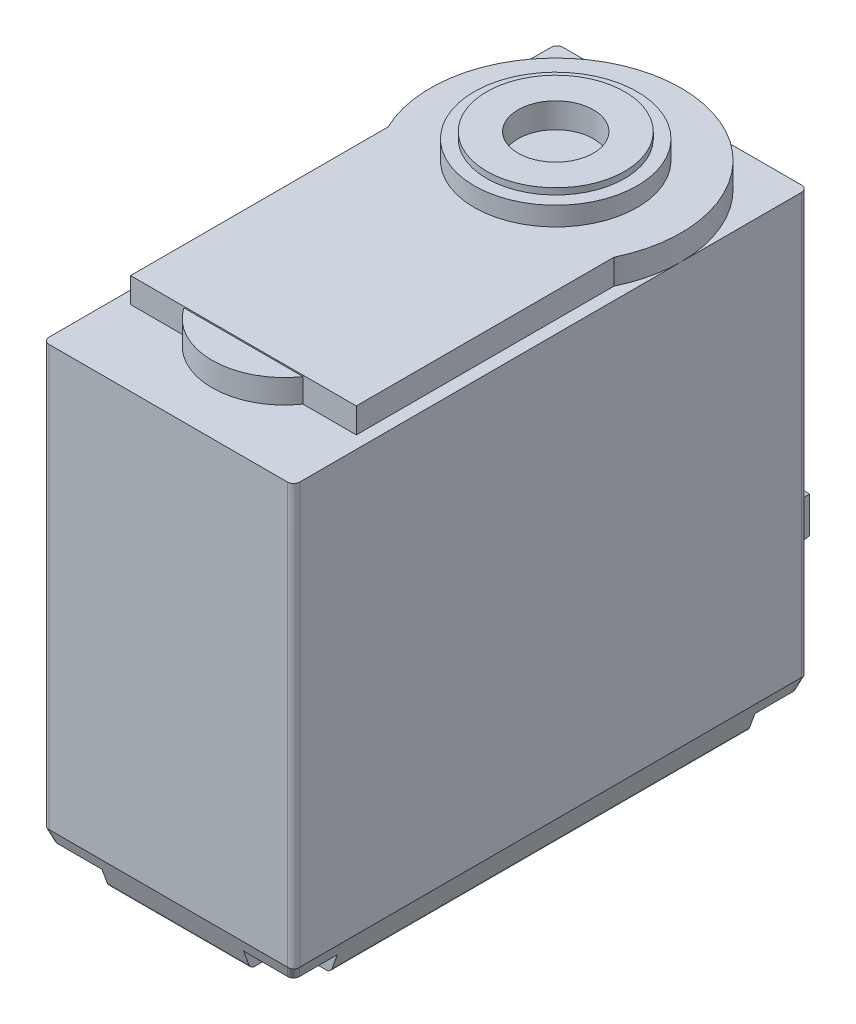
from build123d import *

# Parameters (mm, degrees)
SKETCH1_W             = 41
SKETCH1_H             = 36
BOSS_EXTRUDE1_DEPTH   = 20
BOSS_EXTRUDE2_DEPTH   = 2
BOSS_EXTRUDE3_DEPTH   = 1.9
SKETCH3_R             = 6.5
SKETCH3_R_2           = 5.5
BOSS_EXTRUDE4_DEPTH   = 1.5
SKETCH3_3_R           = 5.5
SKETCH3_3_R_2         = 3
BOSS_EXTRUDE5_DEPTH   = 2
SKETCH10_R            = 0.825
CUT_EXTRUDE3_DEPTH    = 1.5
SKETCH10_10_R         = 0.825
CUT_EXTRUDE4_DEPTH    = 32
CHAMFER2_SIZE         = 2.5
CHAMFER2_SIZE2        = 0.909925586
CHAMFER2_PART_2_SIZE  = 2.5
CHAMFER2_PART_2_SIZE2 = 0.909925586
CHAMFER2_PART_3_SIZE  = 2.5
CHAMFER2_PART_3_SIZE2 = 0.909925586
CHAMFER2_PART_4_SIZE  = 2.5
CHAMFER2_PART_4_SIZE2 = 0.909925586
FILLET2_R             = 0.5
SKETCH11_W            = 7.5
SKETCH11_H            = 4.1
BOSS_EXTRUDE10_DEPTH  = 7
BOSS_EXTRUDE10_TAPER  = 5


with BuildPart() as part:
    # Sketch1 → Boss-Extrude1 (new body)
    with BuildSketch(Plane(origin=(0, 0, 0), x_dir=(0, 0, -1), z_dir=(1, 0, 0))):
        Rectangle(SKETCH1_W, SKETCH1_H)
    extrude(amount=BOSS_EXTRUDE1_DEPTH)

    # Sketch2 → Boss-Extrude2 (add)
    with BuildSketch(Plane(origin=(0, 18, 0), x_dir=(1, 0, 0), z_dir=(0, 1, 0))):
        with BuildLine():
            ThreePointArc((20, 10.4), (7.763932023, 20.146794345), (1, 6.041101056))
            Line((1, 6.041101056), (1, 10.5))
            Line((1, 10.5), (19, 10.5))
            Line((19, 10.5), (19, 6.041101056))
            ThreePointArc((19, 6.041101056), (19.746794345, 8.163932022), (20, 10.4))
        make_face()
        with BuildLine():
            Line((1, 10.5), (1, 6.041101056))
            ThreePointArc((1, 6.041101056), (10, 0.4), (19, 6.041101056))
            Line((19, 6.041101056), (19, 10.5))
            Line((19, 10.5), (1, 10.5))
        make_face()
        with BuildLine():
            Line((1, 6.041101056), (1, -14.5))
            Line((1, -14.5), (5.25, -14.5))
            Line((5.25, -14.5), (14.75, -14.5))
            Line((14.75, -14.5), (19, -14.5))
            Line((19, -14.5), (19, 6.041101056))
            ThreePointArc((19, 6.041101056), (10, 0.4), (1, 6.041101056))
        make_face()
    extrude(amount=BOSS_EXTRUDE2_DEPTH)

    # Sketch2<3> → Boss-Extrude3 (add)
    with BuildSketch(Plane(origin=(0, 18, 0), x_dir=(1, 0, 0), z_dir=(0, 1, 0))):
        with BuildLine():
            Line((14.75, -14.5), (5.25, -14.5))
            ThreePointArc((5.25, -14.5), (10, -17), (14.75, -14.5))
        make_face()
    extrude(amount=BOSS_EXTRUDE3_DEPTH)

    # Sketch3 → Boss-Extrude4 (add)
    with BuildSketch(Plane(origin=(0, 20, 0), x_dir=(1, 0, 0), z_dir=(0, 1, 0))):
        with Locations(Location((10, 10.4, 0), (0, 0, 270))):
            Circle(SKETCH3_R)
        with Locations(Location((10, 10.4, 0), (0, 0, 270))):
            Circle(SKETCH3_R_2, mode=Mode.SUBTRACT)
    extrude(amount=BOSS_EXTRUDE4_DEPTH)

    # Sketch3<3> → Boss-Extrude5 (add)
    with BuildSketch(Plane(origin=(0, 20, 0), x_dir=(1, 0, 0), z_dir=(0, 1, 0))):
        with Locations(Location((10, 10.4, 0), (0, 0, 270))):
            Circle(SKETCH3_3_R)
        with Locations(Location((10, 10.4, 0), (0, 0, 270))):
            Circle(SKETCH3_3_R_2, mode=Mode.SUBTRACT)
    extrude(amount=BOSS_EXTRUDE5_DEPTH)

    # Sketch10 → Cut-Extrude3 (cut)
    # profile 1 of 4: a face of its own
    with BuildSketch(Plane.XZ.offset(18)):
        with BuildLine():
            Line((0, 16.65), (2.5, 16.65))
            ThreePointArc((2.5, 16.65), (3.808147545, 17.191852455), (4.35, 18.5))
            Line((4.35, 18.5), (4.35, 20.5))
            Line((4.35, 20.5), (0, 20.5))
            Line((0, 20.5), (0, 16.65))
        make_face()
        with Locations(Location((2.5, 18.5, 0), (0, 0, 270))):
            Circle(SKETCH10_R, mode=Mode.SUBTRACT)
    # profile 2 of 4: a face of its own
    with BuildSketch(Plane.XZ.offset(18)):
        with BuildLine():
            Line((15.65, 18.5), (15.65, 20.5))
            Line((15.65, 20.5), (20, 20.5))
            Line((20, 20.5), (20, 16.65))
            Line((20, 16.65), (17.5, 16.65))
            ThreePointArc((17.5, 16.65), (16.191852455, 17.191852455), (15.65, 18.5))
        make_face()
        with Locations(Location((17.5, 18.5, 0), (0, 0, 90))):
            Circle(SKETCH10_R, mode=Mode.SUBTRACT)
    # profile 3 of 4: a face of its own
    with BuildSketch(Plane.XZ.offset(18)):
        with BuildLine():
            Line((4.35, -18.5), (4.35, -20.5))
            Line((4.35, -20.5), (0, -20.5))
            Line((0, -20.5), (0, -16.65))
            Line((0, -16.65), (2.5, -16.65))
            ThreePointArc((2.5, -16.65), (3.808147545, -17.191852455), (4.35, -18.5))
        make_face()
        with Locations(Location((2.5, -18.5, 0), (0, 0, 90))):
            Circle(SKETCH10_R, mode=Mode.SUBTRACT)
    # profile 4 of 4: a face of its own
    with BuildSketch(Plane.XZ.offset(18)):
        with BuildLine():
            Line((20, -16.65), (17.5, -16.65))
            ThreePointArc((17.5, -16.65), (16.191852455, -17.191852455), (15.65, -18.5))
            Line((15.65, -18.5), (15.65, -20.5))
            Line((15.65, -20.5), (20, -20.5))
            Line((20, -20.5), (20, -16.65))
        make_face()
        with Locations(Location((17.5, -18.5, 0), (0, 0, 270))):
            Circle(SKETCH10_R, mode=Mode.SUBTRACT)
    extrude(amount=-CUT_EXTRUDE3_DEPTH, mode=Mode.SUBTRACT)

    # Sketch10<10> → Cut-Extrude4 (cut)
    with BuildSketch(Plane.XZ.offset(18)):
        with Locations(Location((2.5, 18.5, 0), (0, 0, 270))):
            Circle(SKETCH10_10_R)
        with Locations(Location((17.5, 18.5, 0), (0, 0, 270))):
            Circle(SKETCH10_10_R)
        with Locations(Location((17.5, -18.5, 0), (0, 0, 270))):
            Circle(SKETCH10_10_R)
        with Locations(Location((2.5, -18.5, 0), (0, 0, 270))):
            Circle(SKETCH10_10_R)
    extrude(amount=-CUT_EXTRUDE4_DEPTH, mode=Mode.SUBTRACT)

    # Chamfer2
    chamfer2_edges = [part.edges().sort_by_distance(p)[0] for p in [
        (10, -18, 20.5),
    ]]
    chamfer2_side = [part.faces().sort_by_distance(p)[0] for p in [
        (10, 0.318427753, 20.5),
    ]]
    chamfer(chamfer2_edges, length=CHAMFER2_SIZE, length2=CHAMFER2_SIZE2, reference=chamfer2_side[0])

    # Chamfer2 part 2
    chamfer2_part_2_edges = [part.edges().sort_by_distance(p)[0] for p in [
        (20, -18, 0),
    ]]
    chamfer2_part_2_side = [part.faces().sort_by_distance(p)[0] for p in [
        (20, 0.13604937, 0),
    ]]
    chamfer(chamfer2_part_2_edges, length=CHAMFER2_PART_2_SIZE, length2=CHAMFER2_PART_2_SIZE2, reference=chamfer2_part_2_side[0])

    # Chamfer2 part 3
    chamfer2_part_3_edges = [part.edges().sort_by_distance(p)[0] for p in [
        (10, -18, -20.5),
    ]]
    chamfer2_part_3_side = [part.faces().sort_by_distance(p)[0] for p in [
        (10, 0.318427753, -20.5),
    ]]
    chamfer(chamfer2_part_3_edges, length=CHAMFER2_PART_3_SIZE, length2=CHAMFER2_PART_3_SIZE2, reference=chamfer2_part_3_side[0])

    # Chamfer2 part 4
    chamfer2_part_4_edges = [part.edges().sort_by_distance(p)[0] for p in [
        (0, -18, 0),
    ]]
    chamfer2_part_4_side = [part.faces().sort_by_distance(p)[0] for p in [
        (0, 0.13604937, 0),
    ]]
    chamfer(chamfer2_part_4_edges, length=CHAMFER2_PART_4_SIZE, length2=CHAMFER2_PART_4_SIZE2, reference=chamfer2_part_4_side[0])

    # Fillet2
    # the kernel refuses this fillet: 0.5 mm, written as the material it takes off along each edge
    with BuildSketch(Plane(origin=(20, 19.25, 20.5), x_dir=(-1, 0, 0), z_dir=(0, -1, 0)), Plane(origin=(0, -16.75, -20.5), x_dir=(0, 0, 1), z_dir=(0, 1, 0)), Plane(origin=(20, -16.75, -20.5), x_dir=(-1, 0, 0), z_dir=(0, 1, 0)), Plane(origin=(0, 19.25, 20.5), x_dir=(0, 0, -1), z_dir=(0, -1, 0))) as fillet2_piece_1:
        with BuildLine():
            CenterArc((FILLET2_R, FILLET2_R), FILLET2_R, 180, 90)
            Line((0, FILLET2_R), (0, 0))
            Line((0, 0), (FILLET2_R, 0))
        make_face()
    extrude(amount=36, mode=Mode.SUBTRACT)
    with BuildSketch(Plane(origin=(19.090074414, -18, 17.525259423), x_dir=(-1, 0, 0), z_dir=(0, 0, -1))) as fillet2_piece_2:
        with BuildLine():
            CenterArc((FILLET2_R * 0.70020753821, FILLET2_R), FILLET2_R, 200, 70)
            Line((-FILLET2_R * 0.239485082576, FILLET2_R * 0.657979856674), (0, 0))
            Line((0, 0), (FILLET2_R * 0.70020753821, 0))
        make_face()
    extrude(amount=35.050518846, mode=Mode.SUBTRACT)
    with BuildSketch(Plane(origin=(3.474740577, -18, 19.590074414), x_dir=(0, 0, -1), z_dir=(1, 0, 0))) as fillet2_piece_3:
        with BuildLine():
            CenterArc((FILLET2_R * 0.70020753821, FILLET2_R), FILLET2_R, 200, 70)
            Line((-FILLET2_R * 0.239485082576, FILLET2_R * 0.657979856674), (0, 0))
            Line((0, 0), (FILLET2_R * 0.70020753821, 0))
        make_face()
    extrude(amount=13.050518846, mode=Mode.SUBTRACT)
    with BuildSketch(Plane(origin=(0.909925586, -18, 17.525259423), x_dir=(1, 0, 0), z_dir=(0, 0, -1))) as fillet2_piece_4:
        with BuildLine():
            CenterArc((FILLET2_R * 0.70020753821, -FILLET2_R), FILLET2_R, 90, 70)
            Line((-FILLET2_R * 0.239485082576, -FILLET2_R * 0.657979856674), (0, 0))
            Line((0, 0), (FILLET2_R * 0.70020753821, 0))
        make_face()
    extrude(amount=35.050518846, mode=Mode.SUBTRACT)
    with BuildSketch(Plane(origin=(3.474740577, -18, -19.590074414), x_dir=(0, 0, 1), z_dir=(1, 0, 0))) as fillet2_piece_5:
        with BuildLine():
            CenterArc((FILLET2_R * 0.70020753821, -FILLET2_R), FILLET2_R, 90, 70)
            Line((-FILLET2_R * 0.239485082576, -FILLET2_R * 0.657979856674), (0, 0))
            Line((0, 0), (FILLET2_R * 0.70020753821, 0))
        make_face()
    extrude(amount=13.050518846, mode=Mode.SUBTRACT)
    with BuildSketch(Plane(origin=(20.359668978, -14.511817604, 20.859668978), x_dir=(-0.9461886483394649, 0.3040991697893318, 0.1106830460683808), z_dir=(-0.3236155771181854, -0.8891264907159879, -0.3236155771181854)), Plane(origin=(-0.359668978, -14.511817604, 20.859668978), x_dir=(-0.11068304606838054, 0.30409916978933194, -0.9461886483394649), z_dir=(0.3236155771181852, -0.8891264907159879, -0.32361557711818534))) as fillet2_piece_6:
        with BuildLine():
            CenterArc((FILLET2_R * 0.889126490716, FILLET2_R), FILLET2_R, 186.717713464, 83.282286536)
            Line((-FILLET2_R * 0.104008041637, FILLET2_R * 0.883022221559), (0, 0))
            Line((0, 0), (FILLET2_R * 0.889126490716, 0))
        make_face()
    extrude(amount=3.347515592, mode=Mode.SUBTRACT)
    with BuildSketch(Plane(origin=(20.359668978, -14.511817604, -20.859668978), x_dir=(-0.9461886483394651, 0.3040991697893314, -0.1106830460683821), z_dir=(-0.3236155771181854, -0.8891264907159879, 0.3236155771181854)), Plane(origin=(-0.359668978, -14.511817604, -20.859668978), x_dir=(-0.11068304606838054, 0.30409916978933194, 0.946188648339465), z_dir=(0.3236155771181852, -0.8891264907159879, 0.32361557711818534))) as fillet2_piece_7:
        with BuildLine():
            CenterArc((FILLET2_R * 0.889126490716, -FILLET2_R), FILLET2_R, 90, 83.282286536)
            Line((-FILLET2_R * 0.104008041637, -FILLET2_R * 0.883022221559), (0, 0))
            Line((0, 0), (FILLET2_R * 0.889126490716, 0))
        make_face()
    extrude(amount=3.347515592, mode=Mode.SUBTRACT)

    # Sketch11 → Boss-Extrude10 (add)
    with BuildSketch(Plane(origin=(0, 0, -20.5), x_dir=(-1, 0, 0), z_dir=(0, 0, -1))):
        with Locations((-10, -11.45)):
            Rectangle(SKETCH11_W, SKETCH11_H)
    extrude(amount=BOSS_EXTRUDE10_DEPTH, taper=BOSS_EXTRUDE10_TAPER)


solid = part.part
